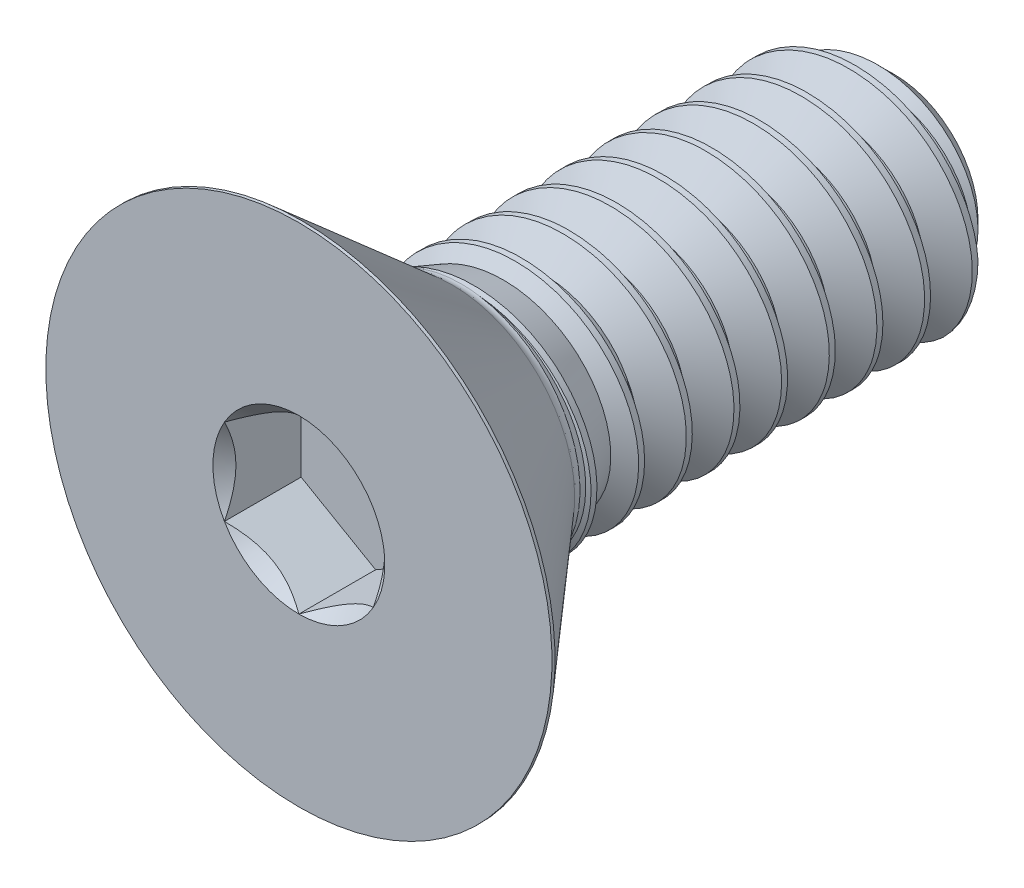
from build123d import *

# Parameters (mm, degrees)
SKETCH10_R         = 2.291358881
CUT_EXTRUDE2_DEPTH = 2.0447
CUT_EXTRUDE2_DRAFT = -45
CUT_EXTRUDE1_DEPTH = 2.0447
CUT_SWEEP1_PITCH   = 1.27
CUT_SWEEP1_TO      = 11.558428


with BuildPart() as part:
    # Sketch11 → Revolve1 (revolve)
    with BuildSketch(Plane(origin=(0, 0, 0), x_dir=(0, 0, -1), z_dir=(1, 0, 0))):
        with BuildLine():
            Line((-7.855712, 6.7437), (-3.8481, 3.259936038))
            ThreePointArc((-3.8481, 3.259936038), (-3.742193592, 3.196928347), (-3.620928247, 3.175))
            Line((-3.620928247, 3.175), (6.985, 3.175))
            Line((6.985, 3.175), (7.9375, 2.2225))
            Line((7.9375, 2.2225), (7.9375, 0))
            Line((7.9375, 0), (-7.9375, 0))
            Line((-7.9375, 0), (-7.9375, 6.7437))
            Line((-7.9375, 6.7437), (-7.855712, 6.7437))
        make_face()
    revolve(axis=Axis((0, 0, -7.9375), (0, 0, 1)))


with BuildPart() as cut_extrude2_tool:
    # Sketch10 → Cut-Extrude2 (with draft: the straight prism first)
    with BuildSketch(Plane.XY.offset(7.9375)):
        Circle(SKETCH10_R)
    extrude(amount=-CUT_EXTRUDE2_DEPTH)
    # Cut-Extrude2: the draft: its side faces are tilted about the plane it starts from
    cut_extrude2_sides = [cut_extrude2_tool.faces().sort_by_distance(p)[0] for p in [
        (-2.291358881, 0, 6.91515),
    ]]
    draft(cut_extrude2_sides, Plane.XY.offset(7.9375), CUT_EXTRUDE2_DRAFT)


with BuildPart() as part_1:
    add(part.part)

    # Cut-Extrude2: cut by cut_extrude2_tool
    add(cut_extrude2_tool.part, mode=Mode.SUBTRACT)

    # Sketch9 → Cut-Extrude1 (cut)
    with BuildSketch(Plane.XY.offset(7.9375)):
        Polygon((1.984375, -1.14567944), (1.984375, 1.14567944), (0, 2.291358881), (-1.984375, 1.14567944), (-1.984375, -1.14567944), (0, -2.291358881), align=None)
    extrude(amount=-CUT_EXTRUDE1_DEPTH, mode=Mode.SUBTRACT)


with BuildPart() as body_2:
    # Split1: the piece on the far side of the plane
    add(part_1.part)
    split(bisect_by=Plane.XY.offset(3.620928247), keep=Keep.BOTTOM)

    # Cut-Sweep1: arcs per turn and ends read off the stored shape
    # Cut-Sweep1: the profile of Sketch4 screwed along a right-hand helix through 12.5 turns, 8 arcs to a turn; built about Z, then put on its axis
    cut_sweep1_z = Axis((0, 0, 0), (0, 0, 1))
    cut_sweep1_corners = [(3.243740766, 0, 0.0396875), (3.243740766, 0, -1.1509375), (2.350110803, 0, -0.635), (2.350110803, 0, -0.47625)]
    with BuildLine(mode=Mode.PRIVATE) as cut_sweep1_profile:
        Line(cut_sweep1_corners[0], cut_sweep1_corners[1])
        Line(cut_sweep1_corners[1], cut_sweep1_corners[2])
        Line(cut_sweep1_corners[2], cut_sweep1_corners[3])
        Line(cut_sweep1_corners[3], cut_sweep1_corners[0])
    cut_sweep1_cap = Face(cut_sweep1_profile.wire())
    cut_sweep1_turn_angles = [0, 22.5, 45, 67.5, 90, 112.5, 135, 157.5, 180, 202.5, 225, 247.5, 270, 292.5, 315, 337.5, 360]
    cut_sweep1_turn_weights = [1, 0.9238795325112867, 1, 0.9238795325112867, 1, 0.9238795325112867, 1, 0.9238795325112867, 1, 0.9238795325112867, 1, 0.9238795325112867, 1, 0.9238795325112867, 1, 0.9238795325112867, 1]
    cut_sweep1_turn_rails = [Edge.make_bspline([Vector(p[0], p[1], 0).rotate(cut_sweep1_z, cut_sweep1_turn_angles[k]) / cut_sweep1_turn_weights[k] + Vector(0, 0, p[2] + CUT_SWEEP1_PITCH * cut_sweep1_turn_angles[k] / 360) for k in range(17)], [0, 0, 0, 1, 1, 2, 2, 3, 3, 4, 4, 5, 5, 6, 6, 7, 7, 8, 8, 8], 2, cut_sweep1_turn_weights) for p in cut_sweep1_corners]
    cut_sweep1_turn_sides = [Face.make_surface_from_curves(cut_sweep1_turn_rails[p[0]], cut_sweep1_turn_rails[p[1]]) for p in [(0, 1), (1, 2), (2, 3), (3, 0)]]
    cut_sweep1_last_angles = [4320, 4342.5, 4365, 4387.5, 4410, 4432.5, 4455, 4477.5, 4500]
    cut_sweep1_last_weights = [1, 0.9238795325112867, 1, 0.9238795325112867, 1, 0.9238795325112867, 1, 0.9238795325112746, 1]
    cut_sweep1_last_rails = [Edge.make_bspline([Vector(p[0], p[1], 0).rotate(cut_sweep1_z, cut_sweep1_last_angles[k]) / cut_sweep1_last_weights[k] + Vector(0, 0, p[2] + CUT_SWEEP1_PITCH * cut_sweep1_last_angles[k] / 360) for k in range(9)], [0, 0, 0, 1, 1, 2, 2, 3, 3, 4, 4, 4], 2, cut_sweep1_last_weights) for p in cut_sweep1_corners]
    cut_sweep1_last_sides = [Face.make_surface_from_curves(cut_sweep1_last_rails[p[0]], cut_sweep1_last_rails[p[1]]) for p in [(0, 1), (1, 2), (2, 3), (3, 0)]]
    cut_sweep1 = Plane(origin=(0, 0, -7.9375), x_dir=(0, 1, 0), z_dir=(0, 0, 1)) * split(Solid(Shell([*[p.moved(Location((0, 0, CUT_SWEEP1_PITCH * i))) for i in range(12) for p in cut_sweep1_turn_sides], *cut_sweep1_last_sides, cut_sweep1_cap, cut_sweep1_cap.rotate(cut_sweep1_z, 4500).moved(Location((0, 0, CUT_SWEEP1_PITCH * 4500 / 360)))])), bisect_by=Plane.XY.offset(CUT_SWEEP1_TO), keep=Keep.BOTTOM, mode=Mode.PRIVATE)
    add(cut_sweep1, mode=Mode.SUBTRACT)


with BuildPart() as part_2:
    add(part_1.part)

    # Split1
    split(bisect_by=Plane.XY.offset(3.620928247), keep=Keep.TOP)

    add(body_2.part)  # Boss-Extrude2 merges body 2
    # Boss-Extrude2 cone 1 section (through the dimple's axis) → Boss-Extrude2 (revolve)
    with BuildSketch(Plane(origin=(0, 0, 3.620928247), x_dir=(0, -1, 0), z_dir=(1, 0, 0))):
        Polygon((0, 0), (3.175, 0), (0, 8.723240807), align=None)
    revolve(axis=Axis((0, 0, 3.620928247), (0, 0, -1)))


solid = part_2.part
